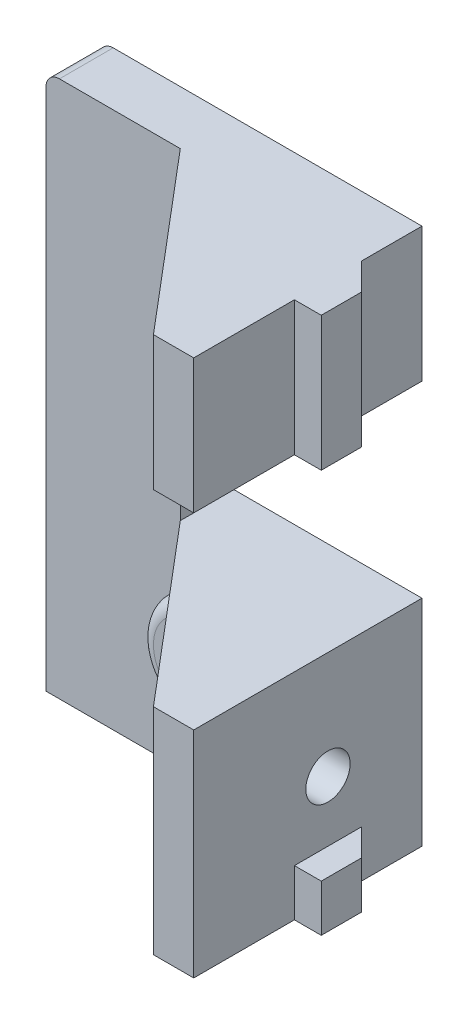
from build123d import *

# Parameters (mm, degrees)
SKETCH1_W               = 24
SKETCH1_H               = 40
BOSS_EXTRUDE1_DEPTH     = 4
FILLET1_R               = 1
CUT_EXTRUDE2_DEPTH      = 43.860474698
CUT_EXTRUDE2_DEPTH_BACK = 43.860474698
SKETCH3_W               = 14
SKETCH3_H               = 14
SKETCH5_W               = 3
SKETCH5_H               = 16
BOSS_EXTRUDE2_DEPTH     = 13
BOSS_EXTRUDE3_DEPTH     = 3
BOSS_EXTRUDE4_DEPTH     = 3
SKETCH8_R               = 1.65
CUT_EXTRUDE4_DEPTH      = 3
SKETCH9_W               = 3
SKETCH9_H               = 10
BOSS_EXTRUDE5_DEPTH     = 13
BOSS_EXTRUDE6_DEPTH     = 6
SKETCH11_W              = 5
SKETCH11_H              = 10
BOSS_EXTRUDE7_DEPTH     = 2
CHAMFER1_SIZE           = 2
SKETCH12_R              = 3.065
CUT_EXTRUDE5_DEPTH      = 3.1
SKETCH15_R              = 1.6
CUT_EXTRUDE6_DEPTH      = 2.12
SKETCH17_R              = 4
BOSS_EXTRUDE8_DEPTH     = 1
FILLET3_R               = 1
SKETCH21_R              = 2.25
BOSS_EXTRUDE11_DEPTH    = 2.9
SKETCH23_W              = 5
SKETCH23_H              = 3.5
BOSS_EXTRUDE12_DEPTH    = 2
CHAMFER2_SIZE           = 2
FILLET5_R               = 0.5


with BuildPart() as part:
    # Sketch1 → Boss-Extrude1 (new body)
    with BuildSketch(Plane.XY):
        with Locations((-14.758064516, 13.241935484)):
            Rectangle(SKETCH1_W, SKETCH1_H)
    extrude(amount=BOSS_EXTRUDE1_DEPTH)

    # Fillet1
    fillet1_edges = [part.edges().sort_by_distance(p)[0] for p in [
        (-26.758064516, 33.241935484, 2),
    ]]
    fillet(fillet1_edges, radius=FILLET1_R)

    # Sketch3 → Cut-Extrude2 (cut, two sides: drawn at the far end of the back side and taken through both)
    with BuildSketch(Plane(origin=(0, 0, 0), x_dir=(-1, 0, 0), z_dir=(0, 0, -1)).offset(-CUT_EXTRUDE2_DEPTH_BACK)):
        with Locations((9.758064516, 16.241935484)):
            Rectangle(SKETCH3_W, SKETCH3_H)
    extrude(amount=CUT_EXTRUDE2_DEPTH + CUT_EXTRUDE2_DEPTH_BACK, mode=Mode.SUBTRACT)

    # Sketch5 → Boss-Extrude2 (add)
    with BuildSketch(Plane.XY.offset(4)):
        with Locations((-4.258064516, 1.241935484)):
            Rectangle(SKETCH5_W, SKETCH5_H)
    extrude(amount=BOSS_EXTRUDE2_DEPTH)

    # Sketch6 → Boss-Extrude3 (add)
    with BuildSketch(Plane.XZ.offset(6.758064516)):
        Polygon((-5.758064516, 17), (-16.666359721, 4), (-5.758064516, 4), align=None)
    extrude(amount=-BOSS_EXTRUDE3_DEPTH)

    # Sketch7 → Boss-Extrude4 (add)
    with BuildSketch(Plane(origin=(0, 9.241935484, 0), x_dir=(1, 0, 0), z_dir=(0, 1, 0))):
        Polygon((-5.758064516, -17), (-16.758064516, -4), (-5.758064516, -4), align=None)
    extrude(amount=-BOSS_EXTRUDE4_DEPTH)

    # Sketch8 → Cut-Extrude4 (cut)
    with BuildSketch(Plane.ZY.offset(5.758064516)):
        with Locations(Location((7, 1.241935484, 0), (0, 0, 270))):
            Circle(SKETCH8_R)
    extrude(amount=-CUT_EXTRUDE4_DEPTH, mode=Mode.SUBTRACT)

    # Sketch9 → Boss-Extrude5 (add)
    with BuildSketch(Plane.XY.offset(4)):
        with Locations((-4.258064516, 28.241935484)):
            Rectangle(SKETCH9_W, SKETCH9_H)
    extrude(amount=BOSS_EXTRUDE5_DEPTH)

    # Sketch10 → Boss-Extrude6 (add)
    with BuildSketch(Plane(origin=(0, 33.241935484, 0), x_dir=(1, 0, 0), z_dir=(0, 1, 0))):
        Polygon((-5.758064516, -17), (-16.758064516, -4), (-5.758064516, -4), align=None)
    extrude(amount=-BOSS_EXTRUDE6_DEPTH)

    # Sketch11 → Boss-Extrude7 (add)
    with BuildSketch(Plane(origin=(-2.758064516, 0, 0), x_dir=(0, 0, -1), z_dir=(1, 0, 0))):
        with Locations((-7, 28.241935484)):
            Rectangle(SKETCH11_W, SKETCH11_H)
    extrude(amount=BOSS_EXTRUDE7_DEPTH)

    # Chamfer1
    chamfer1_edges = [part.edges().sort_by_distance(p)[0] for p in [
        (-0.758064516, 28.241935484, 4.5),
    ]]
    chamfer(chamfer1_edges, length=CHAMFER1_SIZE - 0.0001)  # a hair under: the kernel refuses the full size

    # Sketch12 → Cut-Extrude5 (cut)
    with BuildSketch(Plane(origin=(0, 0, 0), x_dir=(-1, 0, 0), z_dir=(0, 0, -1))):
        with Locations((14.758064516, 1.241935484)):
            Circle(SKETCH12_R)
    extrude(amount=-CUT_EXTRUDE5_DEPTH, mode=Mode.SUBTRACT)

    # Sketch15 → Cut-Extrude6 (cut)
    with BuildSketch(Plane(origin=(0, 0, 0), x_dir=(-1, 0, 0), z_dir=(0, 0, -1))):
        with Locations((19.758064516, 20.241935484)):
            Circle(SKETCH15_R)
    extrude(amount=-CUT_EXTRUDE6_DEPTH, mode=Mode.SUBTRACT)

    # Sketch17 → Boss-Extrude8 (add)
    with BuildSketch(Plane.XY.offset(4)):
        with Locations((-14.758064516, 1.241935484)):
            Circle(SKETCH17_R)
    extrude(amount=BOSS_EXTRUDE8_DEPTH)

    # Fillet3
    fillet3_edges = [part.edges().sort_by_distance(p)[0] for p in [
        (-18.758064516, 1.241935484, 5),
    ]]
    fillet(fillet3_edges, radius=FILLET3_R - 0.0001)  # a hair under: the kernel refuses the full size

    # Sketch23 → Boss-Extrude12 (add)
    with BuildSketch(Plane(origin=(-2.758064516, 0, 0), x_dir=(0, 0, -1), z_dir=(1, 0, 0))):
        with Locations((-7, -5.008064516)):
            Rectangle(SKETCH23_W, SKETCH23_H)
    extrude(amount=BOSS_EXTRUDE12_DEPTH)

    # Chamfer2
    chamfer2_edges = [part.edges().sort_by_distance(p)[0] for p in [
        (-0.758064516, -5.008064516, 4.5),
    ]]
    chamfer(chamfer2_edges, length=CHAMFER2_SIZE - 0.0001)  # a hair under: the kernel refuses the full size

    # Fillet5
    fillet5_edges = [part.edges().sort_by_distance(p)[0] for p in [
        (-18.158064516, 20.241935484, 0),
    ]]
    fillet(fillet5_edges, radius=FILLET5_R)


with BuildPart() as body_2:
    # Sketch21 → Boss-Extrude11 (new body)
    with BuildSketch(Plane(origin=(0, 0, 0), x_dir=(-1, 0, 0), z_dir=(0, 0, -1))):
        with Locations((14.758064516, 1.241935484)):
            Circle(SKETCH21_R)
    extrude(amount=-BOSS_EXTRUDE11_DEPTH)


solid = Compound([part.part, body_2.part])
